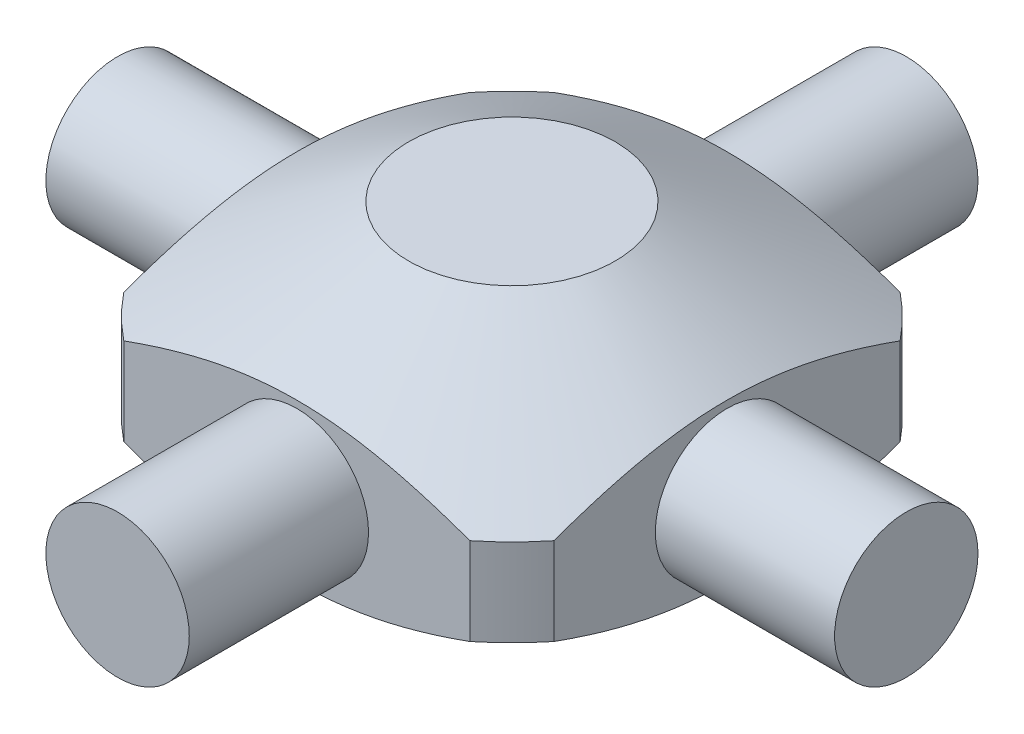
from build123d import *

# Parameters (mm, degrees)
SKETCH1_W                = 6
SKETCH1_H                = 6
BOSS_EXTRUDE1_DEPTH      = 4
CUT_REVOLVE_THIN1_DEPTH  = 4
BOSS_EXTRUDE2_DEPTH      = 5.5
BOSS_EXTRUDE2_DEPTH_BACK = 5.5
SKETCH3_R                = 1
BOSS_EXTRUDE3_DEPTH      = 5.5
BOSS_EXTRUDE3_DEPTH_BACK = 5.5
SKETCH4_R                = 1


with BuildPart() as part:
    # Sketch1 → Boss-Extrude1 (new body)
    with BuildSketch(Plane(origin=(0, 0, 0), x_dir=(1, 0, 0), z_dir=(0, 1, 0))):
        Rectangle(SKETCH1_W, SKETCH1_H)
    extrude(amount=BOSS_EXTRUDE1_DEPTH)

    # Cut-Revolve-Thin1: read off the stored shape, not the designer's step
    # Cut-Revolve-Thin1 outline → Cut-Revolve-Thin1 (cut)
    with BuildSketch(Plane(origin=(0, 0, 0), x_dir=(1, 0, 0), z_dir=(0, 1, 0))):
        with BuildLine():
            ThreePointArc((3, -2.413514817), (2.722595616, -2.722595616), (2.413514817, -3))
            Line((2.413514817, -3), (3, -3))
            Line((3, -3), (3, -2.413514817))
        make_face()
        with BuildLine():
            Line((-3, -3), (-2.413514817, -3))
            ThreePointArc((-2.413514817, -3), (-2.722595616, -2.722595616), (-3, -2.413514817))
            Line((-3, -2.413514817), (-3, -3))
        make_face()
        with BuildLine():
            ThreePointArc((2.413514817, 3), (2.722595616, 2.722595616), (3, 2.413514817))
            Line((3, 2.413514817), (3, 3))
            Line((3, 3), (2.413514817, 3))
        make_face()
        with BuildLine():
            Line((-3, 3), (-3, 2.413514817))
            ThreePointArc((-3, 2.413514817), (-2.722595616, 2.722595616), (-2.413514817, 3))
            Line((-2.413514817, 3), (-3, 3))
        make_face()
    extrude(amount=CUT_REVOLVE_THIN1_DEPTH, mode=Mode.SUBTRACT)

    # Cut-Revolve-Thin1 2 outline → Cut-Revolve-Thin1 2 (revolve, cut)
    with BuildSketch(Plane.XY):
        Polygon((3.850331645, 4), (1.441154273, 4), (3.850331645, 2.609060796), align=None)
        Polygon((3.850331645, 0), (3.850331645, 1.390939204), (1.441154273, 0), align=None)
    revolve(axis=Axis((0, 0, 0), (0, 1, 0)), mode=Mode.SUBTRACT)

    # Sketch3 → Boss-Extrude2 (add, two sides: drawn at the far end of the back side and taken through both)
    with BuildSketch(Plane.XY.offset(-BOSS_EXTRUDE2_DEPTH_BACK)):
        with Locations((0, 2)):
            Circle(SKETCH3_R)
    extrude(amount=BOSS_EXTRUDE2_DEPTH + BOSS_EXTRUDE2_DEPTH_BACK)

    # Sketch4 → Boss-Extrude3 (add, two sides: drawn at the far end of the back side and taken through both)
    with BuildSketch(Plane(origin=(0, 0, 0), x_dir=(0, 0, -1), z_dir=(1, 0, 0)).offset(-BOSS_EXTRUDE3_DEPTH_BACK)):
        with Locations((0, 2)):
            Circle(SKETCH4_R)
    extrude(amount=BOSS_EXTRUDE3_DEPTH + BOSS_EXTRUDE3_DEPTH_BACK)


solid = part.part
